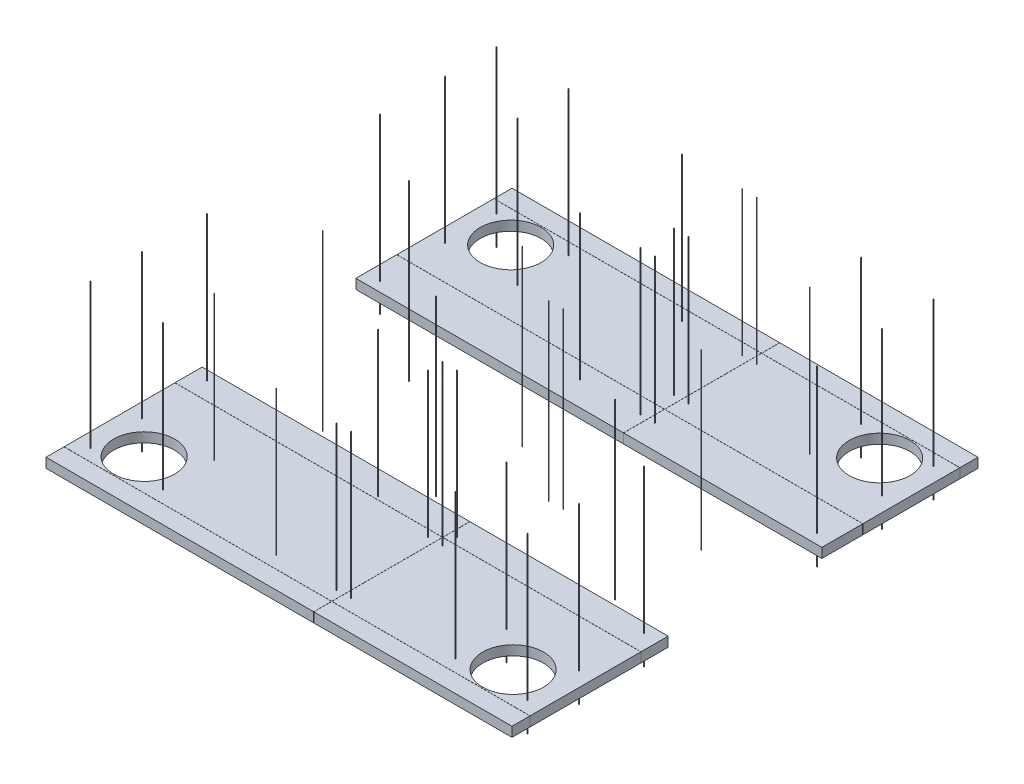
from build123d import *

# Parameters (mm, degrees)
SKETCH1_W                          = 4908.55
SKETCH1_H                          = 4908.55
BOSS_EXTRUDE1_DEPTH                = 101.6
SKETCH2_W                          = 4908.55
SKETCH2_H                          = 1619.25
CUT_EXTRUDE1_DEPTH                 = 3473.355700566
SKETCH4_W                          = 4908.55
SKETCH4_H                          = 1.27
CUT_EXTRUDE_THIN1_DEPTH            = 3473.355700566
CUT_EXTRUDE_THIN2_DEPTH            = 3473.355700566
CUT_EXTRUDE_THIN2_DEPTH_BACK       = 3473.355700566
SKETCH5_W                          = 1.27
SKETCH5_H                          = 4908.55
SKETCH6_R                          = 320.675
DUCT_HOLES_DEPTH                   = 3473.355700566
UNISTRUT_STUD_LAYOUT_DEPTH         = 1524
UNISTRUT_STUD_LAYOUT_DEPTH_BACK    = 304.8
SKETCH7_R                          = 3.175
UNISTRUT_STUD_LAYOUT_2_DEPTH       = 1524
UNISTRUT_STUD_LAYOUT_2_DEPTH_BACK  = 304.8
UNISTRUT_STUD_LAYOUT_3_DEPTH       = 1524
UNISTRUT_STUD_LAYOUT_3_DEPTH_BACK  = 304.8
UNISTRUT_STUD_LAYOUT_4_DEPTH       = 1524
UNISTRUT_STUD_LAYOUT_4_DEPTH_BACK  = 304.8
UNISTRUT_STUD_LAYOUT_5_DEPTH       = 1524
UNISTRUT_STUD_LAYOUT_5_DEPTH_BACK  = 304.8
UNISTRUT_STUD_LAYOUT_6_DEPTH       = 1524
UNISTRUT_STUD_LAYOUT_6_DEPTH_BACK  = 304.8
UNISTRUT_STUD_LAYOUT_7_DEPTH       = 1524
UNISTRUT_STUD_LAYOUT_7_DEPTH_BACK  = 304.8
UNISTRUT_STUD_LAYOUT_8_DEPTH       = 1524
UNISTRUT_STUD_LAYOUT_8_DEPTH_BACK  = 304.8
UNISTRUT_STUD_LAYOUT_9_DEPTH       = 1524
UNISTRUT_STUD_LAYOUT_9_DEPTH_BACK  = 304.8
UNISTRUT_STUD_LAYOUT_10_DEPTH      = 1524
UNISTRUT_STUD_LAYOUT_10_DEPTH_BACK = 304.8
UNISTRUT_STUD_LAYOUT_11_DEPTH      = 1524
UNISTRUT_STUD_LAYOUT_11_DEPTH_BACK = 304.8
UNISTRUT_STUD_LAYOUT_12_DEPTH      = 1524
UNISTRUT_STUD_LAYOUT_12_DEPTH_BACK = 304.8
UNISTRUT_STUD_LAYOUT_13_DEPTH      = 1524
UNISTRUT_STUD_LAYOUT_13_DEPTH_BACK = 304.8
UNISTRUT_STUD_LAYOUT_14_DEPTH      = 1524
UNISTRUT_STUD_LAYOUT_14_DEPTH_BACK = 304.8
UNISTRUT_STUD_LAYOUT_15_DEPTH      = 1524
UNISTRUT_STUD_LAYOUT_15_DEPTH_BACK = 304.8
UNISTRUT_STUD_LAYOUT_16_DEPTH      = 1524
UNISTRUT_STUD_LAYOUT_16_DEPTH_BACK = 304.8
UNISTRUT_STUD_LAYOUT_17_DEPTH      = 1524
UNISTRUT_STUD_LAYOUT_17_DEPTH_BACK = 304.8
UNISTRUT_STUD_LAYOUT_18_DEPTH      = 1524
UNISTRUT_STUD_LAYOUT_18_DEPTH_BACK = 304.8
UNISTRUT_STUD_LAYOUT_19_DEPTH      = 1524
UNISTRUT_STUD_LAYOUT_19_DEPTH_BACK = 304.8
UNISTRUT_STUD_LAYOUT_20_DEPTH      = 1524
UNISTRUT_STUD_LAYOUT_20_DEPTH_BACK = 304.8
UNISTRUT_STUD_LAYOUT_21_DEPTH      = 1524
UNISTRUT_STUD_LAYOUT_21_DEPTH_BACK = 304.8
UNISTRUT_STUD_LAYOUT_22_DEPTH      = 1524
UNISTRUT_STUD_LAYOUT_22_DEPTH_BACK = 304.8
UNISTRUT_STUD_LAYOUT_23_DEPTH      = 1524
UNISTRUT_STUD_LAYOUT_23_DEPTH_BACK = 304.8
UNISTRUT_STUD_LAYOUT_24_DEPTH      = 1524
UNISTRUT_STUD_LAYOUT_24_DEPTH_BACK = 304.8
UNISTRUT_STUD_LAYOUT_25_DEPTH      = 1524
UNISTRUT_STUD_LAYOUT_25_DEPTH_BACK = 304.8
UNISTRUT_STUD_LAYOUT_26_DEPTH      = 1524
UNISTRUT_STUD_LAYOUT_26_DEPTH_BACK = 304.8
UNISTRUT_STUD_LAYOUT_27_DEPTH      = 1524
UNISTRUT_STUD_LAYOUT_27_DEPTH_BACK = 304.8


with BuildPart() as part:
    # Sketch1 → Boss-Extrude1 (new body)
    with BuildSketch(Plane(origin=(0, 0, 0), x_dir=(1, 0, 0), z_dir=(0, 1, 0))):
        Rectangle(SKETCH1_W, SKETCH1_H)
    extrude(amount=BOSS_EXTRUDE1_DEPTH)

    # Sketch2 → Cut-Extrude1 (cut, through all)
    with BuildSketch(Plane(origin=(0, 101.6, 0), x_dir=(1, 0, 0), z_dir=(0, 1, 0))):
        Rectangle(SKETCH2_W, SKETCH2_H)
    extrude(amount=-CUT_EXTRUDE1_DEPTH, mode=Mode.SUBTRACT)


with BuildPart() as cut_extrude1_piece_1:
    # of the separate pieces the step leaves, piece 1, a body of its own (cut_extrude1_pieces)
    add(part.part.solids().sort_by_distance((-2454.275, 0, -2454.275))[0])


with BuildPart() as cut_extrude1_piece_2:
    # of the separate pieces the step leaves, piece 2, a body of its own (cut_extrude1_pieces)
    add(part.part.solids().sort_by_distance((-2454.275, 0, 2454.275))[0])


with BuildPart() as cut_extrude_thin1_tool:
    # Sketch4 → Cut-Extrude-Thin1 (new, through all)
    with BuildSketch(Plane(origin=(0, 101.6, 0), x_dir=(1, 0, 0), z_dir=(0, 1, 0))):
        with Locations((0, -2264.41)):
            Rectangle(SKETCH4_W, SKETCH4_H)
        with Locations((0, -1096.01)):
            Rectangle(SKETCH4_W, SKETCH4_H)
        with Locations((0, 2263.14)):
            Rectangle(SKETCH4_W, SKETCH4_H)
        with Locations((0, 1240.79)):
            Rectangle(SKETCH4_W, SKETCH4_H)
    extrude(amount=-CUT_EXTRUDE_THIN1_DEPTH)


with BuildPart() as cut_extrude1_piece_1_1:
    add(cut_extrude1_piece_1.part)

    # Cut-Extrude-Thin1: cut by cut_extrude_thin1_tool
    add(cut_extrude_thin1_tool.part, mode=Mode.SUBTRACT)


with BuildPart() as cut_extrude1_piece_2_1:
    add(cut_extrude1_piece_2.part)

    # Cut-Extrude-Thin1: cut by cut_extrude_thin1_tool
    add(cut_extrude_thin1_tool.part, mode=Mode.SUBTRACT)


with BuildPart() as cut_extrude_thin1_piece_1:
    # of the separate pieces the step leaves, piece 1, a body of its own (cut_extrude_thin1_pieces)
    add(cut_extrude1_piece_1_1.part.solids().sort_by_distance((-2454.275, 0, -1241.425))[0])


with BuildPart() as cut_extrude_thin1_piece_2:
    # of the separate pieces the step leaves, piece 2, a body of its own (cut_extrude_thin1_pieces)
    add(cut_extrude1_piece_1_1.part.solids().sort_by_distance((-2454.275, 0, -809.625))[0])


with BuildPart() as cut_extrude_thin1_piece_3:
    # of the separate pieces the step leaves, piece 3, a body of its own (cut_extrude_thin1_pieces)
    add(cut_extrude1_piece_1_1.part.solids().sort_by_distance((-2454.275, 0, -2454.275))[0])


with BuildPart() as cut_extrude_thin1_piece_1_of_cut_extrude:
    # of the separate pieces the step leaves, piece 1, a body of its own (cut_extrude_thin1_pieces_of_cut_extrude1)
    add(cut_extrude1_piece_2_1.part.solids().sort_by_distance((-2454.275, 0, 2263.775))[0])


with BuildPart() as cut_extrude_thin1_piece_2_of_cut_extrude:
    # of the separate pieces the step leaves, piece 2, a body of its own (cut_extrude_thin1_pieces_of_cut_extrude1)
    add(cut_extrude1_piece_2_1.part.solids().sort_by_distance((-2454.275, 0, 1095.375))[0])


with BuildPart() as cut_extrude_thin1_piece_3_of_cut_extrude:
    # of the separate pieces the step leaves, piece 3, a body of its own (cut_extrude_thin1_pieces_of_cut_extrude1)
    add(cut_extrude1_piece_2_1.part.solids().sort_by_distance((-2454.275, 0, 2454.275))[0])


with BuildPart() as cut_extrude_thin2_tool:
    # Sketch5 → Cut-Extrude-Thin2 (new, two sides: drawn at the far end of the back side and taken through both)
    with BuildSketch(Plane(origin=(0, 101.6, 0), x_dir=(1, 0, 0), z_dir=(0, 1, 0)).offset(-CUT_EXTRUDE_THIN2_DEPTH_BACK)):
        with Locations((365.76, 0)):
            Rectangle(SKETCH5_W, SKETCH5_H)
    extrude(amount=CUT_EXTRUDE_THIN2_DEPTH + CUT_EXTRUDE_THIN2_DEPTH_BACK)


with BuildPart() as cut_extrude_thin1_piece_1_1:
    add(cut_extrude_thin1_piece_1.part)

    # Cut-Extrude-Thin2: cut by cut_extrude_thin2_tool
    add(cut_extrude_thin2_tool.part, mode=Mode.SUBTRACT)


with BuildPart() as cut_extrude_thin1_piece_2_1:
    add(cut_extrude_thin1_piece_2.part)

    # Cut-Extrude-Thin2: cut by cut_extrude_thin2_tool
    add(cut_extrude_thin2_tool.part, mode=Mode.SUBTRACT)


with BuildPart() as cut_extrude_thin1_piece_3_1:
    add(cut_extrude_thin1_piece_3.part)

    # Cut-Extrude-Thin2: cut by cut_extrude_thin2_tool
    add(cut_extrude_thin2_tool.part, mode=Mode.SUBTRACT)


with BuildPart() as cut_extrude_thin1_piece_1_of_cut_extrude_1:
    add(cut_extrude_thin1_piece_1_of_cut_extrude.part)

    # Cut-Extrude-Thin2: cut by cut_extrude_thin2_tool
    add(cut_extrude_thin2_tool.part, mode=Mode.SUBTRACT)


with BuildPart() as cut_extrude_thin1_piece_2_of_cut_extrude_1:
    add(cut_extrude_thin1_piece_2_of_cut_extrude.part)

    # Cut-Extrude-Thin2: cut by cut_extrude_thin2_tool
    add(cut_extrude_thin2_tool.part, mode=Mode.SUBTRACT)


with BuildPart() as cut_extrude_thin1_piece_3_of_cut_extrude_1:
    add(cut_extrude_thin1_piece_3_of_cut_extrude.part)

    # Cut-Extrude-Thin2: cut by cut_extrude_thin2_tool
    add(cut_extrude_thin2_tool.part, mode=Mode.SUBTRACT)


with BuildPart() as cut_extrude_thin2_piece_1:
    # of the separate pieces the step leaves, piece 1, a body of its own (cut_extrude_thin2_pieces)
    add(cut_extrude_thin1_piece_1_1.part.solids().sort_by_distance((-2454.275, 0, -1241.425))[0])


with BuildPart() as cut_extrude_thin2_piece_2:
    # of the separate pieces the step leaves, piece 2, a body of its own (cut_extrude_thin2_pieces)
    add(cut_extrude_thin1_piece_1_1.part.solids().sort_by_distance((2454.275, 0, -2262.505))[0])


with BuildPart() as cut_extrude_thin2_piece_1_of_cut_extrude:
    # of the separate pieces the step leaves, piece 1, a body of its own (cut_extrude_thin2_pieces_of_cut_extrude)
    add(cut_extrude_thin1_piece_2_1.part.solids().sort_by_distance((-2454.275, 0, -809.625))[0])


with BuildPart() as cut_extrude_thin2_piece_2_of_cut_extrude:
    # of the separate pieces the step leaves, piece 2, a body of its own (cut_extrude_thin2_pieces_of_cut_extrude)
    add(cut_extrude_thin1_piece_2_1.part.solids().sort_by_distance((2454.275, 0, -1240.155))[0])


with BuildPart() as cut_extrude_thin2_piece_1_of_cut_ext_2:
    # of the separate pieces the step leaves, piece 1, a body of its own (cut_extrude_thin2_pieces_of_cut_extr_2)
    add(cut_extrude_thin1_piece_3_1.part.solids().sort_by_distance((-2454.275, 0, -2454.275))[0])


with BuildPart() as cut_extrude_thin2_piece_2_of_cut_ext_2:
    # of the separate pieces the step leaves, piece 2, a body of its own (cut_extrude_thin2_pieces_of_cut_extr_2)
    add(cut_extrude_thin1_piece_3_1.part.solids().sort_by_distance((366.395, 0, -2454.275))[0])


with BuildPart() as cut_extrude_thin2_piece_1_of_cut_ext_3:
    # of the separate pieces the step leaves, piece 1, a body of its own (cut_extrude_thin2_pieces_of_cut_extr_3)
    add(cut_extrude_thin1_piece_1_of_cut_extrude_1.part.solids().sort_by_distance((-2454.275, 0, 2263.775))[0])


with BuildPart() as cut_extrude_thin2_piece_2_of_cut_ext_3:
    # of the separate pieces the step leaves, piece 2, a body of its own (cut_extrude_thin2_pieces_of_cut_extr_3)
    add(cut_extrude_thin1_piece_1_of_cut_extrude_1.part.solids().sort_by_distance((2454.275, 0, 1096.645))[0])


with BuildPart() as cut_extrude_thin2_piece_1_of_cut_ext_4:
    # of the separate pieces the step leaves, piece 1, a body of its own (cut_extrude_thin2_pieces_of_cut_extr_4)
    add(cut_extrude_thin1_piece_2_of_cut_extrude_1.part.solids().sort_by_distance((-2454.275, 0, 1095.375))[0])


with BuildPart() as cut_extrude_thin2_piece_2_of_cut_ext_4:
    # of the separate pieces the step leaves, piece 2, a body of its own (cut_extrude_thin2_pieces_of_cut_extr_4)
    add(cut_extrude_thin1_piece_2_of_cut_extrude_1.part.solids().sort_by_distance((2454.275, 0, 809.625))[0])


with BuildPart() as cut_extrude_thin2_piece_1_of_cut_ext_5:
    # of the separate pieces the step leaves, piece 1, a body of its own (cut_extrude_thin2_pieces_of_cut_extr_5)
    add(cut_extrude_thin1_piece_3_of_cut_extrude_1.part.solids().sort_by_distance((-2454.275, 0, 2454.275))[0])


with BuildPart() as cut_extrude_thin2_piece_2_of_cut_ext_5:
    # of the separate pieces the step leaves, piece 2, a body of its own (cut_extrude_thin2_pieces_of_cut_extr_5)
    add(cut_extrude_thin1_piece_3_of_cut_extrude_1.part.solids().sort_by_distance((2454.275, 0, 2265.045))[0])


with BuildPart() as duct_holes_tool:
    # Sketch6 → DUCT HOLES (new, through all)
    with BuildSketch(Plane(origin=(0, 101.6, 0), x_dir=(1, 0, 0), z_dir=(0, 1, 0))):
        with Locations((1943.1, 1929.13)):
            Circle(SKETCH6_R)
        with Locations((-1943.1, 1929.13)):
            Circle(SKETCH6_R)
        with Locations((-1943.1, -1931.67)):
            Circle(SKETCH6_R)
        with Locations((1943.1, -1931.67)):
            Circle(SKETCH6_R)
    extrude(amount=-DUCT_HOLES_DEPTH)


with BuildPart() as cut_extrude_thin2_piece_1_1:
    add(cut_extrude_thin2_piece_1.part)

    # DUCT HOLES: cut by duct_holes_tool
    add(duct_holes_tool.part, mode=Mode.SUBTRACT)


with BuildPart() as cut_extrude_thin2_piece_2_1:
    add(cut_extrude_thin2_piece_2.part)

    # DUCT HOLES: cut by duct_holes_tool
    add(duct_holes_tool.part, mode=Mode.SUBTRACT)


with BuildPart() as cut_extrude_thin2_piece_1_of_cut_ext_3_1:
    add(cut_extrude_thin2_piece_1_of_cut_ext_3.part)

    # DUCT HOLES: cut by duct_holes_tool
    add(duct_holes_tool.part, mode=Mode.SUBTRACT)


with BuildPart() as cut_extrude_thin2_piece_2_of_cut_ext_3_1:
    add(cut_extrude_thin2_piece_2_of_cut_ext_3.part)

    # DUCT HOLES: cut by duct_holes_tool
    add(duct_holes_tool.part, mode=Mode.SUBTRACT)


with BuildPart() as body_13:
    # Sketch7 → UNISTRUT STUD LAYOUT (new, two sides: drawn at the far end of the back side and taken through both)
    with BuildSketch(Plane(origin=(0, 101.6, 0), x_dir=(1, 0, 0), z_dir=(0, 1, 0)).offset(-UNISTRUT_STUD_LAYOUT_DEPTH_BACK)):
        with Locations((1539.875, 1597.025)):
            Circle(SKETCH7_R)
    extrude(amount=UNISTRUT_STUD_LAYOUT_DEPTH + UNISTRUT_STUD_LAYOUT_DEPTH_BACK)


with BuildPart() as body_14:
    # Sketch7 → UNISTRUT STUD LAYOUT 2 (new, two sides: drawn at the far end of the back side and taken through both)
    with BuildSketch(Plane(origin=(0, 101.6, 0), x_dir=(1, 0, 0), z_dir=(0, 1, 0)).offset(-UNISTRUT_STUD_LAYOUT_2_DEPTH_BACK)):
        with Locations((-1539.875, 1597.025)):
            Circle(SKETCH7_R)
    extrude(amount=UNISTRUT_STUD_LAYOUT_2_DEPTH + UNISTRUT_STUD_LAYOUT_2_DEPTH_BACK)


with BuildPart() as body_15:
    # Sketch7 → UNISTRUT STUD LAYOUT 3 (new, two sides: drawn at the far end of the back side and taken through both)
    with BuildSketch(Plane(origin=(0, 101.6, 0), x_dir=(1, 0, 0), z_dir=(0, 1, 0)).offset(-UNISTRUT_STUD_LAYOUT_3_DEPTH_BACK)):
        with Locations((441.325, 1063.625)):
            Circle(SKETCH7_R)
    extrude(amount=UNISTRUT_STUD_LAYOUT_3_DEPTH + UNISTRUT_STUD_LAYOUT_3_DEPTH_BACK)


with BuildPart() as body_16:
    # Sketch7 → UNISTRUT STUD LAYOUT 4 (new, two sides: drawn at the far end of the back side and taken through both)
    with BuildSketch(Plane(origin=(0, 101.6, 0), x_dir=(1, 0, 0), z_dir=(0, 1, 0)).offset(-UNISTRUT_STUD_LAYOUT_4_DEPTH_BACK)):
        with Locations((-346.075, 2136.775)):
            Circle(SKETCH7_R)
    extrude(amount=UNISTRUT_STUD_LAYOUT_4_DEPTH + UNISTRUT_STUD_LAYOUT_4_DEPTH_BACK)


with BuildPart() as body_17:
    # Sketch7 → UNISTRUT STUD LAYOUT 5 (new, two sides: drawn at the far end of the back side and taken through both)
    with BuildSketch(Plane(origin=(0, 101.6, 0), x_dir=(1, 0, 0), z_dir=(0, 1, 0)).offset(-UNISTRUT_STUD_LAYOUT_5_DEPTH_BACK)):
        with Locations((-1539.875, 2136.775)):
            Circle(SKETCH7_R)
    extrude(amount=UNISTRUT_STUD_LAYOUT_5_DEPTH + UNISTRUT_STUD_LAYOUT_5_DEPTH_BACK)


with BuildPart() as body_18:
    # Sketch7 → UNISTRUT STUD LAYOUT 6 (new, two sides: drawn at the far end of the back side and taken through both)
    with BuildSketch(Plane(origin=(0, 101.6, 0), x_dir=(1, 0, 0), z_dir=(0, 1, 0)).offset(-UNISTRUT_STUD_LAYOUT_6_DEPTH_BACK)):
        with Locations((1539.875, 2136.775)):
            Circle(SKETCH7_R)
    extrude(amount=UNISTRUT_STUD_LAYOUT_6_DEPTH + UNISTRUT_STUD_LAYOUT_6_DEPTH_BACK)


with BuildPart() as body_19:
    # Sketch7 → UNISTRUT STUD LAYOUT 7 (new, two sides: drawn at the far end of the back side and taken through both)
    with BuildSketch(Plane(origin=(0, 101.6, 0), x_dir=(1, 0, 0), z_dir=(0, 1, 0)).offset(-UNISTRUT_STUD_LAYOUT_7_DEPTH_BACK)):
        with Locations((-346.075, 1063.625)):
            Circle(SKETCH7_R)
    extrude(amount=UNISTRUT_STUD_LAYOUT_7_DEPTH + UNISTRUT_STUD_LAYOUT_7_DEPTH_BACK)


with BuildPart() as body_20:
    # Sketch7 → UNISTRUT STUD LAYOUT 8 (new, two sides: drawn at the far end of the back side and taken through both)
    with BuildSketch(Plane(origin=(0, 101.6, 0), x_dir=(1, 0, 0), z_dir=(0, 1, 0)).offset(-UNISTRUT_STUD_LAYOUT_8_DEPTH_BACK)):
        with Locations((-2301.875, 1597.025)):
            Circle(SKETCH7_R)
    extrude(amount=UNISTRUT_STUD_LAYOUT_8_DEPTH + UNISTRUT_STUD_LAYOUT_8_DEPTH_BACK)


with BuildPart() as body_21:
    # Sketch7 → UNISTRUT STUD LAYOUT 9 (new, two sides: drawn at the far end of the back side and taken through both)
    with BuildSketch(Plane(origin=(0, 101.6, 0), x_dir=(1, 0, 0), z_dir=(0, 1, 0)).offset(-UNISTRUT_STUD_LAYOUT_9_DEPTH_BACK)):
        with Locations((2301.875, 1597.025)):
            Circle(SKETCH7_R)
    extrude(amount=UNISTRUT_STUD_LAYOUT_9_DEPTH + UNISTRUT_STUD_LAYOUT_9_DEPTH_BACK)


with BuildPart() as body_22:
    # Sketch7 → UNISTRUT STUD LAYOUT 10 (new, two sides: drawn at the far end of the back side and taken through both)
    with BuildSketch(Plane(origin=(0, 101.6, 0), x_dir=(1, 0, 0), z_dir=(0, 1, 0)).offset(-UNISTRUT_STUD_LAYOUT_10_DEPTH_BACK)):
        with Locations((-2301.875, 2136.775)):
            Circle(SKETCH7_R)
    extrude(amount=UNISTRUT_STUD_LAYOUT_10_DEPTH + UNISTRUT_STUD_LAYOUT_10_DEPTH_BACK)


with BuildPart() as body_23:
    # Sketch7 → UNISTRUT STUD LAYOUT 11 (new, two sides: drawn at the far end of the back side and taken through both)
    with BuildSketch(Plane(origin=(0, 101.6, 0), x_dir=(1, 0, 0), z_dir=(0, 1, 0)).offset(-UNISTRUT_STUD_LAYOUT_11_DEPTH_BACK)):
        with Locations((2301.875, 2136.775)):
            Circle(SKETCH7_R)
    extrude(amount=UNISTRUT_STUD_LAYOUT_11_DEPTH + UNISTRUT_STUD_LAYOUT_11_DEPTH_BACK)


with BuildPart() as body_24:
    # Sketch7 → UNISTRUT STUD LAYOUT 12 (new, two sides: drawn at the far end of the back side and taken through both)
    with BuildSketch(Plane(origin=(0, 101.6, 0), x_dir=(1, 0, 0), z_dir=(0, 1, 0)).offset(-UNISTRUT_STUD_LAYOUT_12_DEPTH_BACK)):
        with Locations((288.925, 1416.685)):
            Circle(SKETCH7_R)
    extrude(amount=UNISTRUT_STUD_LAYOUT_12_DEPTH + UNISTRUT_STUD_LAYOUT_12_DEPTH_BACK)


with BuildPart() as body_25:
    # Sketch7 → UNISTRUT STUD LAYOUT 13 (new, two sides: drawn at the far end of the back side and taken through both)
    with BuildSketch(Plane(origin=(0, 101.6, 0), x_dir=(1, 0, 0), z_dir=(0, 1, 0)).offset(-UNISTRUT_STUD_LAYOUT_13_DEPTH_BACK)):
        with Locations((441.325, 1416.685)):
            Circle(SKETCH7_R)
    extrude(amount=UNISTRUT_STUD_LAYOUT_13_DEPTH + UNISTRUT_STUD_LAYOUT_13_DEPTH_BACK)


with BuildPart() as body_26:
    # Sketch7 → UNISTRUT STUD LAYOUT 14 (new, two sides: drawn at the far end of the back side and taken through both)
    with BuildSketch(Plane(origin=(0, 101.6, 0), x_dir=(1, 0, 0), z_dir=(0, 1, 0)).offset(-UNISTRUT_STUD_LAYOUT_14_DEPTH_BACK)):
        with Locations((288.925, 1063.625)):
            Circle(SKETCH7_R)
    extrude(amount=UNISTRUT_STUD_LAYOUT_14_DEPTH + UNISTRUT_STUD_LAYOUT_14_DEPTH_BACK)


with BuildPart() as body_27:
    # Sketch7 → UNISTRUT STUD LAYOUT 15 (new, two sides: drawn at the far end of the back side and taken through both)
    with BuildSketch(Plane(origin=(0, 101.6, 0), x_dir=(1, 0, 0), z_dir=(0, 1, 0)).offset(-UNISTRUT_STUD_LAYOUT_15_DEPTH_BACK)):
        with Locations((441.325, -1020.445)):
            Circle(SKETCH7_R)
    extrude(amount=UNISTRUT_STUD_LAYOUT_15_DEPTH + UNISTRUT_STUD_LAYOUT_15_DEPTH_BACK)


with BuildPart() as body_28:
    # Sketch7 → UNISTRUT STUD LAYOUT 16 (new, two sides: drawn at the far end of the back side and taken through both)
    with BuildSketch(Plane(origin=(0, 101.6, 0), x_dir=(1, 0, 0), z_dir=(0, 1, 0)).offset(-UNISTRUT_STUD_LAYOUT_16_DEPTH_BACK)):
        with Locations((288.925, -1020.445)):
            Circle(SKETCH7_R)
    extrude(amount=UNISTRUT_STUD_LAYOUT_16_DEPTH + UNISTRUT_STUD_LAYOUT_16_DEPTH_BACK)


with BuildPart() as body_29:
    # Sketch7 → UNISTRUT STUD LAYOUT 17 (new, two sides: drawn at the far end of the back side and taken through both)
    with BuildSketch(Plane(origin=(0, 101.6, 0), x_dir=(1, 0, 0), z_dir=(0, 1, 0)).offset(-UNISTRUT_STUD_LAYOUT_17_DEPTH_BACK)):
        with Locations((288.925, -1172.845)):
            Circle(SKETCH7_R)
    extrude(amount=UNISTRUT_STUD_LAYOUT_17_DEPTH + UNISTRUT_STUD_LAYOUT_17_DEPTH_BACK)


with BuildPart() as body_30:
    # Sketch7 → UNISTRUT STUD LAYOUT 18 (new, two sides: drawn at the far end of the back side and taken through both)
    with BuildSketch(Plane(origin=(0, 101.6, 0), x_dir=(1, 0, 0), z_dir=(0, 1, 0)).offset(-UNISTRUT_STUD_LAYOUT_18_DEPTH_BACK)):
        with Locations((441.325, -1172.845)):
            Circle(SKETCH7_R)
    extrude(amount=UNISTRUT_STUD_LAYOUT_18_DEPTH + UNISTRUT_STUD_LAYOUT_18_DEPTH_BACK)


with BuildPart() as body_31:
    # Sketch7 → UNISTRUT STUD LAYOUT 19 (new, two sides: drawn at the far end of the back side and taken through both)
    with BuildSketch(Plane(origin=(0, 101.6, 0), x_dir=(1, 0, 0), z_dir=(0, 1, 0)).offset(-UNISTRUT_STUD_LAYOUT_19_DEPTH_BACK)):
        with Locations((-2301.875, 911.225)):
            Circle(SKETCH7_R)
    extrude(amount=UNISTRUT_STUD_LAYOUT_19_DEPTH + UNISTRUT_STUD_LAYOUT_19_DEPTH_BACK)


with BuildPart() as body_32:
    # Sketch7 → UNISTRUT STUD LAYOUT 20 (new, two sides: drawn at the far end of the back side and taken through both)
    with BuildSketch(Plane(origin=(0, 101.6, 0), x_dir=(1, 0, 0), z_dir=(0, 1, 0)).offset(-UNISTRUT_STUD_LAYOUT_20_DEPTH_BACK)):
        with Locations((2301.875, 911.225)):
            Circle(SKETCH7_R)
    extrude(amount=UNISTRUT_STUD_LAYOUT_20_DEPTH + UNISTRUT_STUD_LAYOUT_20_DEPTH_BACK)


with BuildPart() as body_33:
    # Sketch7 → UNISTRUT STUD LAYOUT 21 (new, two sides: drawn at the far end of the back side and taken through both)
    with BuildSketch(Plane(origin=(0, 101.6, 0), x_dir=(1, 0, 0), z_dir=(0, 1, 0)).offset(-UNISTRUT_STUD_LAYOUT_21_DEPTH_BACK)):
        with Locations((1539.875, 454.025)):
            Circle(SKETCH7_R)
    extrude(amount=UNISTRUT_STUD_LAYOUT_21_DEPTH + UNISTRUT_STUD_LAYOUT_21_DEPTH_BACK)


with BuildPart() as body_34:
    # Sketch7 → UNISTRUT STUD LAYOUT 22 (new, two sides: drawn at the far end of the back side and taken through both)
    with BuildSketch(Plane(origin=(0, 101.6, 0), x_dir=(1, 0, 0), z_dir=(0, 1, 0)).offset(-UNISTRUT_STUD_LAYOUT_22_DEPTH_BACK)):
        with Locations((-1539.875, 454.025)):
            Circle(SKETCH7_R)
    extrude(amount=UNISTRUT_STUD_LAYOUT_22_DEPTH + UNISTRUT_STUD_LAYOUT_22_DEPTH_BACK)


with BuildPart() as body_35:
    # Sketch7 → UNISTRUT STUD LAYOUT 23 (new, two sides: drawn at the far end of the back side and taken through both)
    with BuildSketch(Plane(origin=(0, 101.6, 0), x_dir=(1, 0, 0), z_dir=(0, 1, 0)).offset(-UNISTRUT_STUD_LAYOUT_23_DEPTH_BACK)):
        with Locations((-346.075, 454.025)):
            Circle(SKETCH7_R)
    extrude(amount=UNISTRUT_STUD_LAYOUT_23_DEPTH + UNISTRUT_STUD_LAYOUT_23_DEPTH_BACK)


with BuildPart() as body_36:
    # Sketch7 → UNISTRUT STUD LAYOUT 24 (new, two sides: drawn at the far end of the back side and taken through both)
    with BuildSketch(Plane(origin=(0, 101.6, 0), x_dir=(1, 0, 0), z_dir=(0, 1, 0)).offset(-UNISTRUT_STUD_LAYOUT_24_DEPTH_BACK)):
        with Locations((441.325, 98.425)):
            Circle(SKETCH7_R)
    extrude(amount=UNISTRUT_STUD_LAYOUT_24_DEPTH + UNISTRUT_STUD_LAYOUT_24_DEPTH_BACK)


with BuildPart() as body_37:
    # Sketch7 → UNISTRUT STUD LAYOUT 25 (new, two sides: drawn at the far end of the back side and taken through both)
    with BuildSketch(Plane(origin=(0, 101.6, 0), x_dir=(1, 0, 0), z_dir=(0, 1, 0)).offset(-UNISTRUT_STUD_LAYOUT_25_DEPTH_BACK)):
        with Locations((288.925, 98.425)):
            Circle(SKETCH7_R)
    extrude(amount=UNISTRUT_STUD_LAYOUT_25_DEPTH + UNISTRUT_STUD_LAYOUT_25_DEPTH_BACK)


with BuildPart() as body_38:
    # Sketch7 → UNISTRUT STUD LAYOUT 26 (new, two sides: drawn at the far end of the back side and taken through both)
    with BuildSketch(Plane(origin=(0, 101.6, 0), x_dir=(1, 0, 0), z_dir=(0, 1, 0)).offset(-UNISTRUT_STUD_LAYOUT_26_DEPTH_BACK)):
        with Locations((288.925, 2136.775)):
            Circle(SKETCH7_R)
    extrude(amount=UNISTRUT_STUD_LAYOUT_26_DEPTH + UNISTRUT_STUD_LAYOUT_26_DEPTH_BACK)


with BuildPart() as body_39:
    # Sketch7 → UNISTRUT STUD LAYOUT 27 (new, two sides: drawn at the far end of the back side and taken through both)
    with BuildSketch(Plane(origin=(0, 101.6, 0), x_dir=(1, 0, 0), z_dir=(0, 1, 0)).offset(-UNISTRUT_STUD_LAYOUT_27_DEPTH_BACK)):
        with Locations((441.325, 2136.775)):
            Circle(SKETCH7_R)
    extrude(amount=UNISTRUT_STUD_LAYOUT_27_DEPTH + UNISTRUT_STUD_LAYOUT_27_DEPTH_BACK)


with BuildPart() as body_40:
    # Mirror3: mirrored copy
    add(body_20.part.mirror(Plane.XY))


with BuildPart() as body_41:
    # Mirror3 2: mirrored copy
    add(body_14.part.mirror(Plane.XY))


with BuildPart() as body_42:
    # Mirror3 3: mirrored copy
    add(body_17.part.mirror(Plane.XY))


with BuildPart() as body_43:
    # Mirror3 4: mirrored copy
    add(body_19.part.mirror(Plane.XY))


with BuildPart() as body_44:
    # Mirror3 5: mirrored copy
    add(body_16.part.mirror(Plane.XY))


with BuildPart() as body_45:
    # Mirror3 6: mirrored copy
    add(body_13.part.mirror(Plane.XY))


with BuildPart() as body_46:
    # Mirror3 7: mirrored copy
    add(body_18.part.mirror(Plane.XY))


with BuildPart() as body_47:
    # Mirror3 8: mirrored copy
    add(body_21.part.mirror(Plane.XY))


with BuildPart() as body_48:
    # Mirror3 9: mirrored copy
    add(body_22.part.mirror(Plane.XY))


with BuildPart() as body_49:
    # Mirror3 10: mirrored copy
    add(body_23.part.mirror(Plane.XY))


with BuildPart() as body_50:
    # Mirror3 11: mirrored copy
    add(body_32.part.mirror(Plane.XY))


with BuildPart() as body_51:
    # Mirror3 12: mirrored copy
    add(body_31.part.mirror(Plane.XY))


with BuildPart() as body_52:
    # Mirror3 13: mirrored copy
    add(body_34.part.mirror(Plane.XY))


with BuildPart() as body_53:
    # Mirror3 14: mirrored copy
    add(body_35.part.mirror(Plane.XY))


with BuildPart() as body_54:
    # Mirror3 15: mirrored copy
    add(body_33.part.mirror(Plane.XY))


with BuildPart() as body_55:
    # Mirror3 16: mirrored copy
    add(body_38.part.mirror(Plane.XY))


with BuildPart() as body_56:
    # Mirror3 17: mirrored copy
    add(body_39.part.mirror(Plane.XY))


solid = Compound([cut_extrude_thin2_piece_1_of_cut_extrude.part, cut_extrude_thin2_piece_2_of_cut_extrude.part, cut_extrude_thin2_piece_1_of_cut_ext_2.part, cut_extrude_thin2_piece_2_of_cut_ext_2.part, cut_extrude_thin2_piece_1_of_cut_ext_4.part, cut_extrude_thin2_piece_2_of_cut_ext_4.part, cut_extrude_thin2_piece_1_of_cut_ext_5.part, cut_extrude_thin2_piece_2_of_cut_ext_5.part, cut_extrude_thin2_piece_1_1.part, cut_extrude_thin2_piece_2_1.part, cut_extrude_thin2_piece_1_of_cut_ext_3_1.part, cut_extrude_thin2_piece_2_of_cut_ext_3_1.part, body_13.part, body_14.part, body_15.part, body_16.part, body_17.part, body_18.part, body_19.part, body_20.part, body_21.part, body_22.part, body_23.part, body_24.part, body_25.part, body_26.part, body_27.part, body_28.part, body_29.part, body_30.part, body_31.part, body_32.part, body_33.part, body_34.part, body_35.part, body_36.part, body_37.part, body_38.part, body_39.part, body_40.part, body_41.part, body_42.part, body_43.part, body_44.part, body_45.part, body_46.part, body_47.part, body_48.part, body_49.part, body_50.part, body_51.part, body_52.part, body_53.part, body_54.part, body_55.part, body_56.part])
